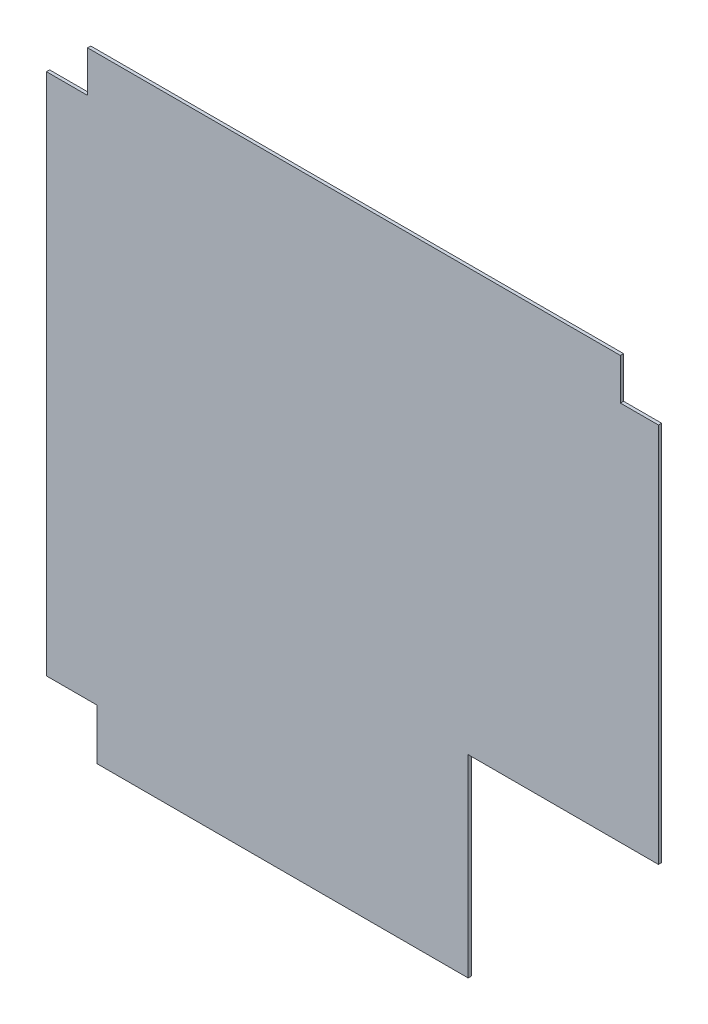
from build123d import *

# Parameters (mm, degrees)
SKETCH1_W           = 742.95
SKETCH1_H           = 615.95
BOSS_EXTRUDE1_DEPTH = 3.175
SKETCH2_W           = 41.275
SKETCH2_H           = 41.275
SKETCH2_W_2         = 50.8
SKETCH2_H_2         = 50.8
SKETCH2_W_3         = 38.1
SKETCH2_W_4         = 190.5
SKETCH2_H_3         = 193.675
CUT_EXTRUDE1_DEPTH  = 483.54777678
SKETCH3_W           = 130.175
SKETCH3_H           = 615.95
CUT_EXTRUDE2_DEPTH  = 483.54777678


with BuildPart() as part:
    # Sketch1 → Boss-Extrude1 (new body)
    with BuildSketch(Plane.XY):
        Rectangle(SKETCH1_W, SKETCH1_H)
    extrude(amount=BOSS_EXTRUDE1_DEPTH)

    # Sketch2 → Cut-Extrude1 (cut, through all)
    with BuildSketch(Plane.XY.offset(3.175)):
        with Locations((-350.8375, 287.3375)):
            Rectangle(SKETCH2_W, SKETCH2_H)
        with Locations((-346.075, -282.575)):
            Rectangle(SKETCH2_W_2, SKETCH2_H_2)
        with Locations((222.25, 287.3375)):
            Rectangle(SKETCH2_W_3, SKETCH2_H)
        with Locations((146.05, -211.1375)):
            Rectangle(SKETCH2_W_4, SKETCH2_H_3)
    extrude(amount=-CUT_EXTRUDE1_DEPTH, mode=Mode.SUBTRACT)

    # Sketch3 → Cut-Extrude2 (cut, through all)
    with BuildSketch(Plane.XY.offset(3.175)):
        with Locations((306.3875, 0)):
            Rectangle(SKETCH3_W, SKETCH3_H)
    extrude(amount=-CUT_EXTRUDE2_DEPTH, mode=Mode.SUBTRACT)


solid = part.part
